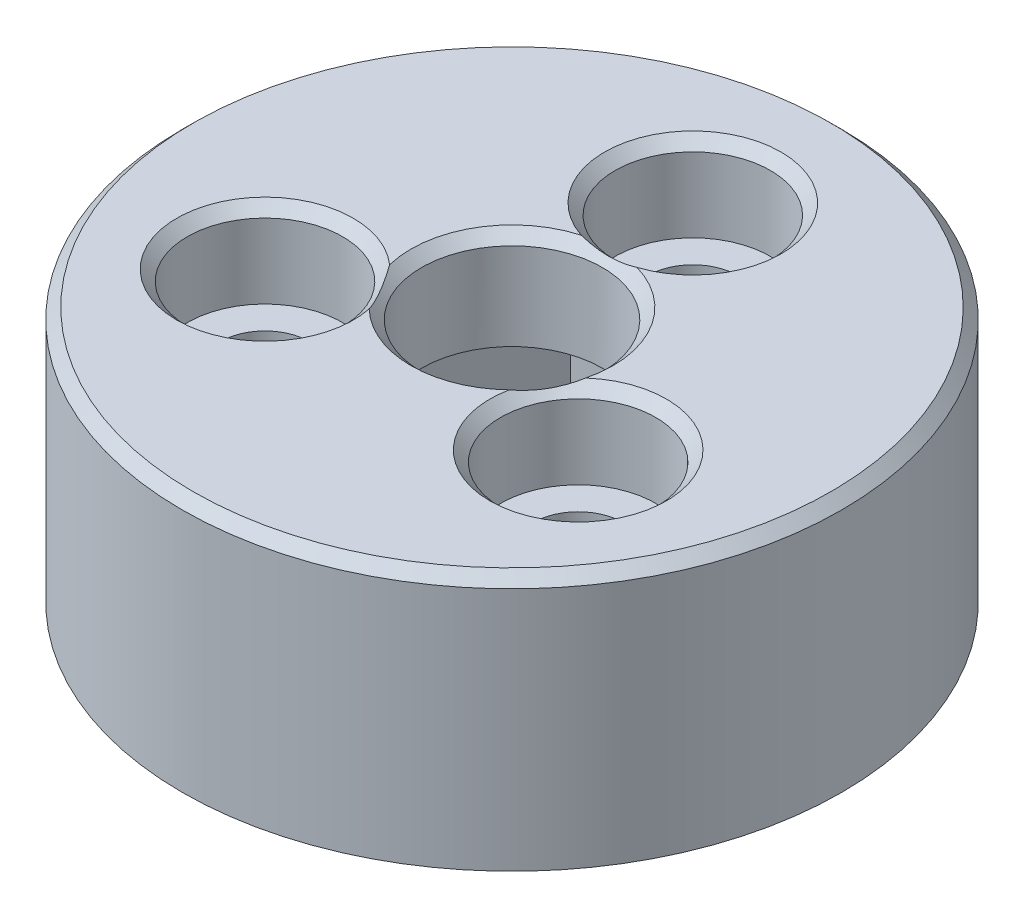
from build123d import *

# Parameters (mm, degrees)
SKETCH1_R           = 15.5
BOSS_EXTRUDE1_DEPTH = 12
SKETCH2_R           = 2.1
CUT_EXTRUDE1_DEPTH  = 25.989997999
SKETCH3_R           = 4.25
CUT_EXTRUDE2_DEPTH  = 25.989997999
CUT_EXTRUDE3_DEPTH  = 7.4
SKETCH5_R           = 3.65
CUT_EXTRUDE4_DEPTH  = 4
CHAMFER1_SIZE       = 0.5
FILLET_1_R          = 0.5


with BuildPart() as part:
    # Sketch1 → Boss-Extrude1 (new body)
    with BuildSketch(Plane(origin=(0, 0, 0), x_dir=(1, 0, 0), z_dir=(0, 1, 0))):
        with Locations(Location((0, 0, 0), (0, 0, 270))):
            Circle(SKETCH1_R)
    extrude(amount=BOSS_EXTRUDE1_DEPTH)

    # Sketch2 → Cut-Extrude1 (cut, through all)
    with BuildSketch(Plane(origin=(0, 12, 0), x_dir=(1, 0, 0), z_dir=(0, 1, 0))):
        with Locations(Location((0, 8.5, 0), (0, 0, 270))):
            Circle(SKETCH2_R)
        with Locations(Location((7.361215932, -4.25, 0), (0, 0, 270))):
            Circle(SKETCH2_R)
        with Locations(Location((-7.361215932, -4.25, 0), (0, 0, 270))):
            Circle(SKETCH2_R)
    extrude(amount=-CUT_EXTRUDE1_DEPTH, mode=Mode.SUBTRACT)

    # Sketch3 → Cut-Extrude2 (cut, through all)
    with BuildSketch(Plane(origin=(0, 12, 0), x_dir=(1, 0, 0), z_dir=(0, 1, 0))):
        with Locations(Location((0, 0, 0), (0, 0, 270))):
            Circle(SKETCH3_R)
    extrude(amount=-CUT_EXTRUDE2_DEPTH, mode=Mode.SUBTRACT)

    # Sketch4 → Cut-Extrude3 (cut)
    with BuildSketch(Plane.XZ):
        Polygon((3.740942098, -6.44013604), (7.447792464, 0.019682871), (3.706850366, 6.459818911), (-3.740942098, 6.44013604), (-7.447792464, -0.019682871), (-3.706850366, -6.459818911), align=None)
    extrude(amount=-CUT_EXTRUDE3_DEPTH, mode=Mode.SUBTRACT)

    # Sketch5 → Cut-Extrude4 (cut)
    with BuildSketch(Plane(origin=(0, 12, 0), x_dir=(1, 0, 0), z_dir=(0, 1, 0))):
        with Locations(Location((0, 8.5, 0), (0, 0, 270))):
            Circle(SKETCH5_R)
        with Locations(Location((7.361215932, -4.25, 0), (0, 0, 270))):
            Circle(SKETCH5_R)
        with Locations(Location((-7.361215932, -4.25, 0), (0, 0, 270))):
            Circle(SKETCH5_R)
    extrude(amount=-CUT_EXTRUDE4_DEPTH, mode=Mode.SUBTRACT)

    # Chamfer1
    # the kernel refuses this chamfer: 0.5 mm, written as the material it takes off along each edge
    with BuildSketch(Plane(origin=(0, 12, 0), x_dir=(0, 0, 1), z_dir=(-1, 0, 0))) as chamfer1_piece_1:
        Polygon((4.25 + CHAMFER1_SIZE, 0), (4.25, -CHAMFER1_SIZE), (4.25, 0), align=None)
    revolve(axis=Axis((0, 12, 0), (0, 1, 0)), mode=Mode.SUBTRACT)
    with BuildSketch(Plane(origin=(0, 12, 0), x_dir=(0, 0, 1), z_dir=(-1, 0, 0))) as chamfer1_piece_2:
        Polygon((15.5, -CHAMFER1_SIZE), (15.5 - CHAMFER1_SIZE, 0), (15.5, 0), align=None)
    revolve(axis=Axis((0, 12, 0), (0, 1, 0)), mode=Mode.SUBTRACT)
    with BuildSketch(Plane(origin=(0, 12, -8.5), x_dir=(0, 0, 1), z_dir=(-1, 0, 0))) as chamfer1_piece_3:
        Polygon((3.65 + CHAMFER1_SIZE, 0), (3.65, -CHAMFER1_SIZE), (3.65, 0), align=None)
    revolve(axis=Axis((0, 12, -8.5), (0, 1, 0)), mode=Mode.SUBTRACT)
    with BuildSketch(Plane(origin=(7.361215932, 12, 4.25), x_dir=(0, 0, 1), z_dir=(-1, 0, 0))) as chamfer1_piece_4:
        Polygon((3.65 + CHAMFER1_SIZE, 0), (3.65, -CHAMFER1_SIZE), (3.65, 0), align=None)
    revolve(axis=Axis((7.361215932, 12, 4.25), (0, 1, 0)), mode=Mode.SUBTRACT)
    with BuildSketch(Plane(origin=(-7.361215932, 12, 4.25), x_dir=(0, 0, 1), z_dir=(-1, 0, 0))) as chamfer1_piece_5:
        Polygon((3.65 + CHAMFER1_SIZE, 0), (3.65, -CHAMFER1_SIZE), (3.65, 0), align=None)
    revolve(axis=Axis((-7.361215932, 12, 4.25), (0, 1, 0)), mode=Mode.SUBTRACT)

    # Скругление1
    fillet_1_edges = [part.edges().sort_by_distance(p)[0] for p in [
        (5.359734874, 3.7, 3.614332183),
        (5.817474247, 3.7, 2.826321101),
        (-5.809970925, 3.7, 2.834500467),
        (-5.356402996, 3.7, 3.624919933),
        (0.450236051, 3.7, -6.44883265),
        (-0.461071251, 3.7, -6.451241034),
    ]]
    fillet(fillet_1_edges, radius=FILLET_1_R)


solid = part.part
